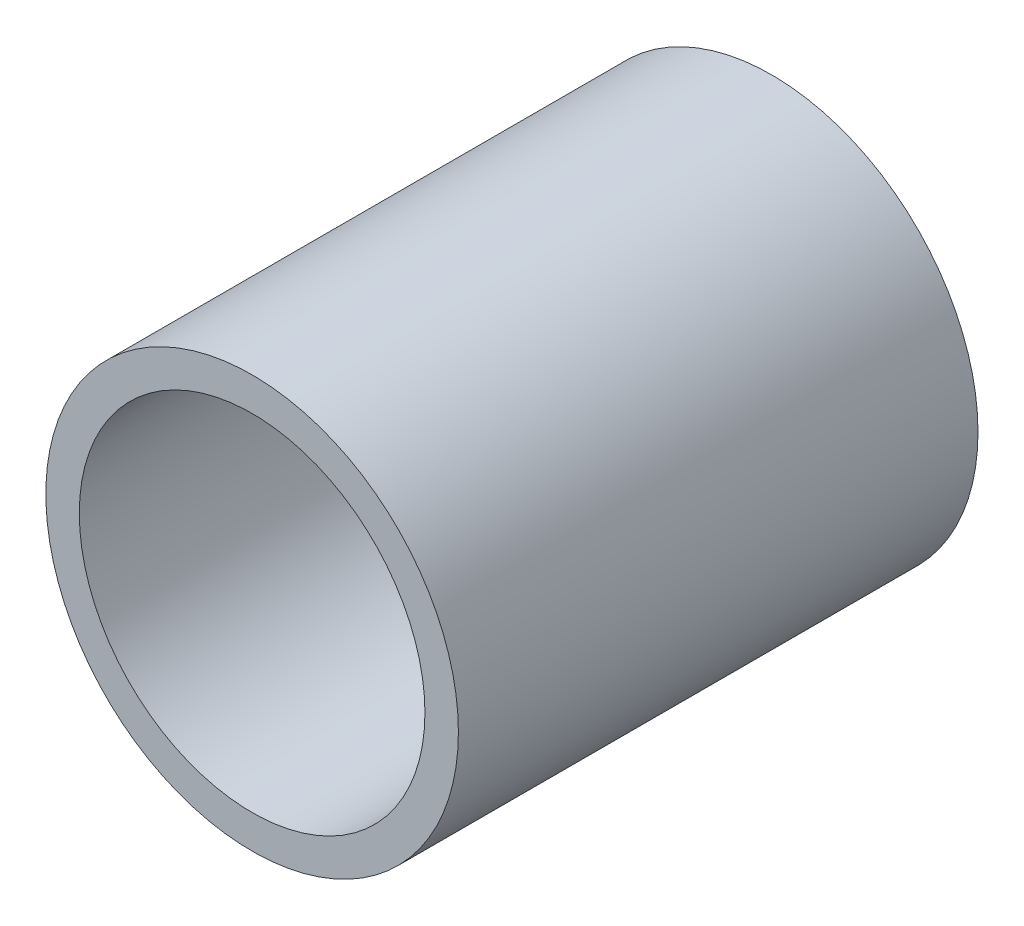
from build123d import *

# Parameters (mm, degrees)
SKETCH1_R           = 18.5
SKETCH1_R_2         = 15.5
BOSS_EXTRUDE1_DEPTH = 46.6


with BuildPart() as part:
    # Sketch1 → Boss-Extrude1 (new body)
    with BuildSketch(Plane.XY):
        with Locations((-0.75198399, 0)):
            Circle(SKETCH1_R)
        with Locations((-0.75198399, 0)):
            Circle(SKETCH1_R_2, mode=Mode.SUBTRACT)
    extrude(amount=BOSS_EXTRUDE1_DEPTH)


solid = part.part
